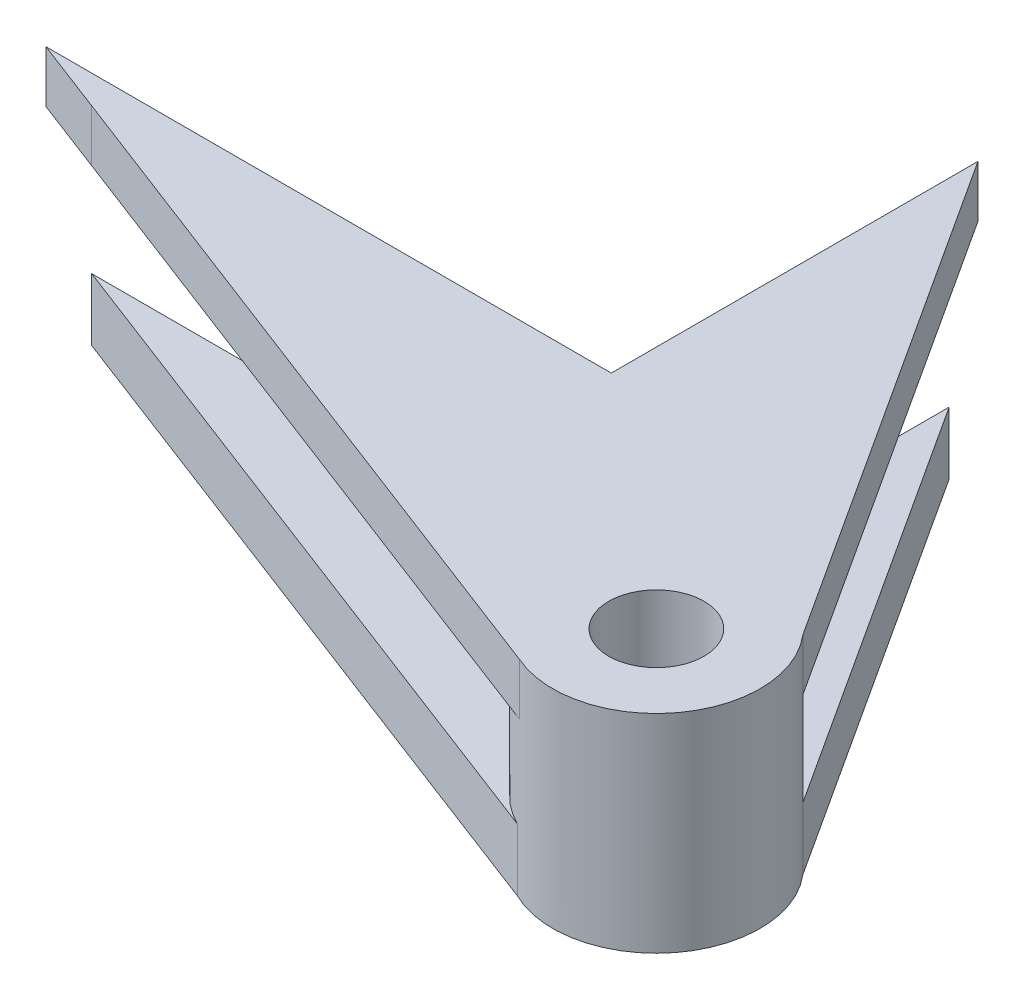
from build123d import *

# Parameters (mm, degrees)
BOSS_EXTRUDE1_DEPTH = 6
SKETCH1_3_R         = 4.590078396
BOSS_EXTRUDE2_DEPTH = 20
BOSS_EXTRUDE3_START = -5
BOSS_EXTRUDE3_DEPTH = 5


with BuildPart() as part:
    # Sketch1 → Boss-Extrude1 (new body)
    with BuildSketch(Plane(origin=(0, 0, 0), x_dir=(1, 0, 0), z_dir=(0, 1, 0))):
        with BuildLine():
            Line((56.557274868, -9.889075942), (30.598786144, 30.167258341))
            Line((30.598786144, 30.167258341), (30.598786144, 0))
            Line((30.598786144, 0), (0, 0))
            Line((0, 0), (-21.824717568, 0))
            Line((-21.824717568, 0), (44.586280869, -25.404884165))
            ThreePointArc((44.586280869, -25.404884165), (41.073109745, -10.318422142), (56.557274868, -9.889075942))
        make_face()
    extrude(amount=BOSS_EXTRUDE1_DEPTH)

    # Sketch1<3> → Boss-Extrude2 (add)
    with BuildSketch(Plane(origin=(0, 0, 0), x_dir=(1, 0, 0), z_dir=(0, 1, 0))):
        with BuildLine():
            ThreePointArc((58.990523554, -16.426986506), (58.36249008, -12.938972253), (56.557274868, -9.889075942))
            ThreePointArc((56.557274868, -9.889075942), (41.073109745, -10.318422142), (44.586280869, -25.404884165))
            ThreePointArc((44.586280869, -25.404884165), (54.280021316, -24.913517801), (58.990523554, -16.426986506))
        make_face()
        with Locations((48.990523554, -16.426986506)):
            Circle(SKETCH1_3_R, mode=Mode.SUBTRACT)
    extrude(amount=BOSS_EXTRUDE2_DEPTH)

    # Sketch2 → Boss-Extrude3 (add)
    with BuildSketch(Plane(origin=(0, 20, 0), x_dir=(1, 0, 0), z_dir=(0, 1, 0)).offset(BOSS_EXTRUDE3_START)):
        with BuildLine():
            ThreePointArc((44.935116081, -25.56775618), (40.956991491, -10.47195816), (56.557274868, -9.889075942))
            Line((56.557274868, -9.889075942), (30.598786144, 30.167258341))
            Line((30.598786144, 30.167258341), (25.489406186, 38.051501286))
            Line((25.489406186, 38.051501286), (25.489406186, 2.72914269))
            Line((25.489406186, 2.72914269), (-28.958979221, 2.72914269))
            Line((-28.958979221, 2.72914269), (-21.824717568, 0))
            Line((-21.824717568, 0), (44.935116081, -25.56775618))
        make_face()
    extrude(amount=BOSS_EXTRUDE3_DEPTH)


solid = part.part
